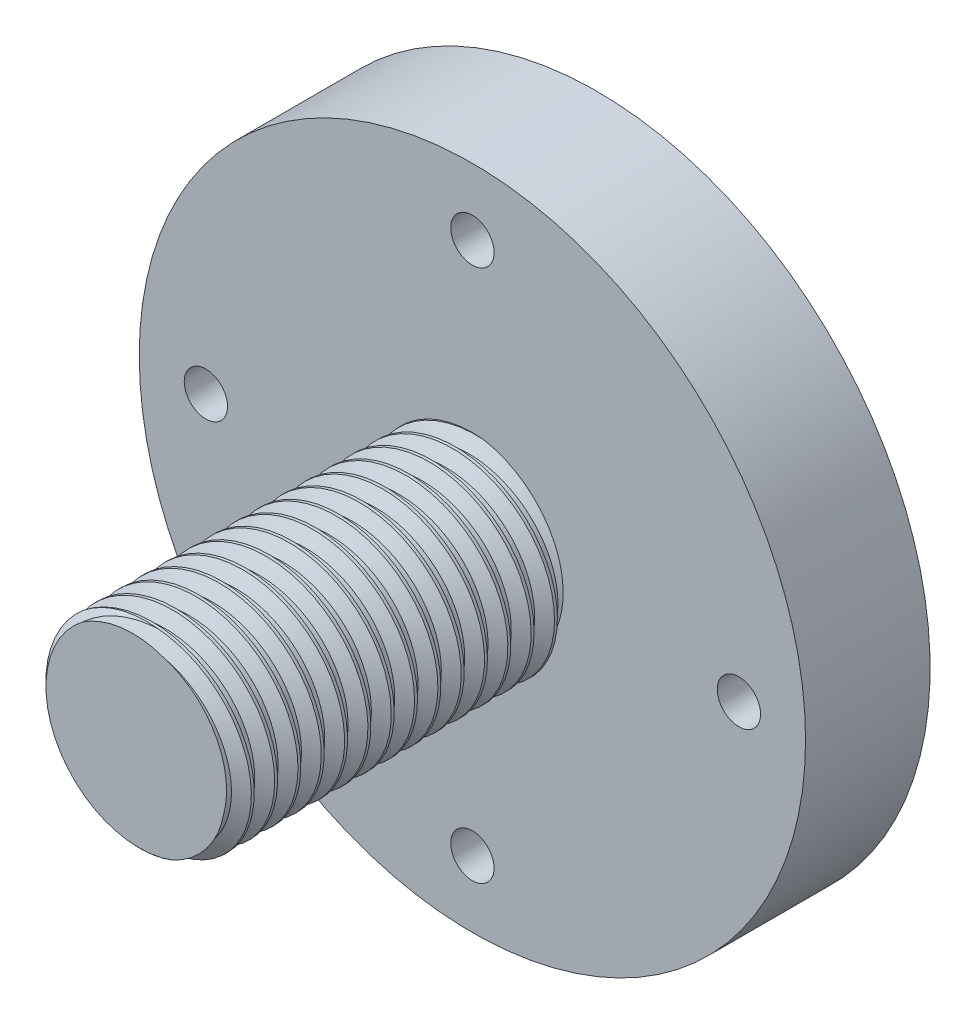
from build123d import *

# Parameters (mm, degrees)
BOSS_EXTRUDE1_DEPTH     = 18.7
SKETCH2_OUTSIDE_W       = 151.258
SKETCH2_OUTSIDE_H       = 144.142
SKETCH2_OUTSIDE_R       = 23
CUT_EXTRUDE1_DEPTH      = 40.799790619
CUT_EXTRUDE1_DRAFT      = -45
MIRROR3_COPY_1_SKETCH_W = 151.258
MIRROR3_COPY_1_SKETCH_H = 144.142
MIRROR3_COPY_1_SKETCH_R = 23
MIRROR3_COPY_1_DEPTH    = 40.799790619
MIRROR3_COPY_1_DRAFT    = -45
SKETCH3_R               = 15
BOSS_EXTRUDE2_DEPTH     = 50
CHAMFER1_SIZE           = 1
THREAD1_PITCH           = 3.5
SKETCH14_R              = 50
SKETCH14_R_2            = 3.25
BOSS_EXTRUDE3_DEPTH     = 18.7


with BuildPart() as part:
    # Sketch1 → Boss-Extrude1 (new body)
    with BuildSketch(Plane.XY.offset(481.485529485)):
        Polygon((13.279056191, -23), (26.558112383, 0), (13.279056191, 23), (-13.279056191, 23), (-26.558112383, 0), (-13.279056191, -23), align=None)
    extrude(amount=BOSS_EXTRUDE1_DEPTH)


with BuildPart() as cut_extrude1_tool:
    # Sketch2 outside → Cut-Extrude1 (with draft: the straight prism first)
    with BuildSketch(Plane.XY.offset(500.185529485)):
        Rectangle(SKETCH2_OUTSIDE_W, SKETCH2_OUTSIDE_H)
        Circle(SKETCH2_OUTSIDE_R, mode=Mode.SUBTRACT)
    extrude(amount=-CUT_EXTRUDE1_DEPTH)
    # Cut-Extrude1: the draft: its side faces are tilted about the plane it starts from
    cut_extrude1_sides = [cut_extrude1_tool.faces().sort_by_distance(p)[0] for p in [
        (0, -72.071, 479.785634176),
        (75.629, 0, 479.785634176),
        (0, 72.071, 479.785634176),
        (-75.629, 0, 479.785634176),
        (-23, 0, 479.785634176),
    ]]
    draft(cut_extrude1_sides, Plane.XY.offset(500.185529485), CUT_EXTRUDE1_DRAFT)


with BuildPart() as part_1:
    add(part.part)

    # Cut-Extrude1: cut by cut_extrude1_tool
    add(cut_extrude1_tool.part, mode=Mode.SUBTRACT)


with BuildPart() as mirror3_copy_1_tool:
    # Mirror3 copy 1 sketch → Mirror3 copy 1 (with draft: the straight prism first)
    with BuildSketch(Plane(origin=(0, 0, 481.485529485), x_dir=(1, 0, 0), z_dir=(0, 0, -1))):
        Rectangle(MIRROR3_COPY_1_SKETCH_W, MIRROR3_COPY_1_SKETCH_H)
        Circle(MIRROR3_COPY_1_SKETCH_R, mode=Mode.SUBTRACT)
    extrude(amount=-MIRROR3_COPY_1_DEPTH)
    # Mirror3 copy 1: the draft: its side faces are tilted about the plane it starts from
    mirror3_copy_1_sides = [mirror3_copy_1_tool.faces().sort_by_distance(p)[0] for p in [
        (0, -72.071, 501.885424795),
        (75.629, 0, 501.885424795),
        (0, 72.071, 501.885424795),
        (-75.629, 0, 501.885424795),
        (-23, 0, 501.885424795),
    ]]
    draft(mirror3_copy_1_sides, Plane(origin=(0, 0, 481.485529485), x_dir=(1, 0, 0), z_dir=(0, 0, -1)), MIRROR3_COPY_1_DRAFT)


with BuildPart() as part_2:
    add(part_1.part)

    # Mirror3 copy 1: cut by mirror3_copy_1_tool
    add(mirror3_copy_1_tool.part, mode=Mode.SUBTRACT)

    # Sketch3 → Boss-Extrude2 (add)
    with BuildSketch(Plane.XY.offset(500.185529485)):
        Circle(SKETCH3_R)
    extrude(amount=BOSS_EXTRUDE2_DEPTH)

    # Chamfer1
    chamfer1_edges = [part_2.edges().sort_by_distance(p)[0] for p in [
        (-15, 0, 550.185529485),
    ]]
    chamfer(chamfer1_edges, length=CHAMFER1_SIZE)

    # Thread1: the profile of Thread Profile3 profile screwed along a right-hand helix of 34.285714 turns, 12 arcs to a turn; built about Z, then put on its axis
    thread1_z = Axis((0, 0, 0), (0, 0, 1))
    thread1_corners = [(15.0003, 0, -0.000173205), (15.0003, 0, 3.062673195), (13.105569437, 0, 1.968749995), (13.105569437, 0, 1.093749995)]
    with BuildLine(mode=Mode.PRIVATE) as thread1_profile:
        Line(thread1_corners[0], thread1_corners[1])
        Line(thread1_corners[1], thread1_corners[2])
        Line(thread1_corners[2], thread1_corners[3])
        Line(thread1_corners[3], thread1_corners[0])
    thread1_cap = Face(thread1_profile.wire())
    thread1_turn_angles = [0, 15, 30, 45, 60, 75, 90, 105, 120, 135, 150, 165, 180, 195, 210, 225, 240, 255, 270, 285, 300, 315, 330, 345, 360]
    thread1_turn_weights = [1, 0.9659258262890683, 1, 0.9659258262890683, 1, 0.9659258262890683, 1, 0.9659258262890683, 1, 0.9659258262890683, 1, 0.9659258262890683, 1, 0.9659258262890683, 1, 0.9659258262890683, 1, 0.9659258262890683, 1, 0.9659258262890683, 1, 0.9659258262890683, 1, 0.9659258262890683, 1]
    thread1_turn_rails = [Edge.make_bspline([Vector(p[0], p[1], 0).rotate(thread1_z, thread1_turn_angles[k]) / thread1_turn_weights[k] + Vector(0, 0, p[2] + THREAD1_PITCH * thread1_turn_angles[k] / 360) for k in range(25)], [0, 0, 0, 1, 1, 2, 2, 3, 3, 4, 4, 5, 5, 6, 6, 7, 7, 8, 8, 9, 9, 10, 10, 11, 11, 12, 12, 12], 2, thread1_turn_weights) for p in thread1_corners]
    thread1_turn_sides = [Face.make_surface_from_curves(thread1_turn_rails[p[0]], thread1_turn_rails[p[1]]) for p in [(0, 1), (1, 2), (2, 3), (3, 0)]]
    thread1_last_angles = [12240, 12255, 12270, 12285, 12300, 12315, 12330, 12336.428571429, 12342.857142857]
    thread1_last_weights = [1, 0.9659258262890683, 1, 0.9659258262890683, 1, 0.9659258262890683, 1, 0.9937122098932459, 1]
    thread1_last_rails = [Edge.make_bspline([Vector(p[0], p[1], 0).rotate(thread1_z, thread1_last_angles[k]) / thread1_last_weights[k] + Vector(0, 0, p[2] + THREAD1_PITCH * thread1_last_angles[k] / 360) for k in range(9)], [0, 0, 0, 1, 1, 2, 2, 3, 3, 4, 4, 4], 2, thread1_last_weights) for p in thread1_corners]
    thread1_last_sides = [Face.make_surface_from_curves(thread1_last_rails[p[0]], thread1_last_rails[p[1]]) for p in [(0, 1), (1, 2), (2, 3), (3, 0)]]
    thread1 = Plane(origin=(0, 0, 560.185529485), x_dir=(-1, 0, 0), z_dir=(0, 0, -1)) * Solid(Shell([*[p.moved(Location((0, 0, THREAD1_PITCH * i))) for i in range(34) for p in thread1_turn_sides], *thread1_last_sides, thread1_cap, thread1_cap.rotate(thread1_z, 12342.857142857).moved(Location((0, 0, THREAD1_PITCH * 12342.857142857 / 360)))]))
    add(thread1, mode=Mode.SUBTRACT)

    # Sketch14 → Boss-Extrude3 (add)
    with BuildSketch(Plane(origin=(0, 0, 481.485529485), x_dir=(-1, 0, 0), z_dir=(0, 0, -1))):
        Circle(SKETCH14_R)
        with Locations((40, 0)):
            Circle(SKETCH14_R_2, mode=Mode.SUBTRACT)
        with Locations((0, 40)):
            Circle(SKETCH14_R_2, mode=Mode.SUBTRACT)
        with Locations((-40, 0)):
            Circle(SKETCH14_R_2, mode=Mode.SUBTRACT)
        with Locations((0, -40)):
            Circle(SKETCH14_R_2, mode=Mode.SUBTRACT)
    extrude(amount=-BOSS_EXTRUDE3_DEPTH)


solid = part_2.part
